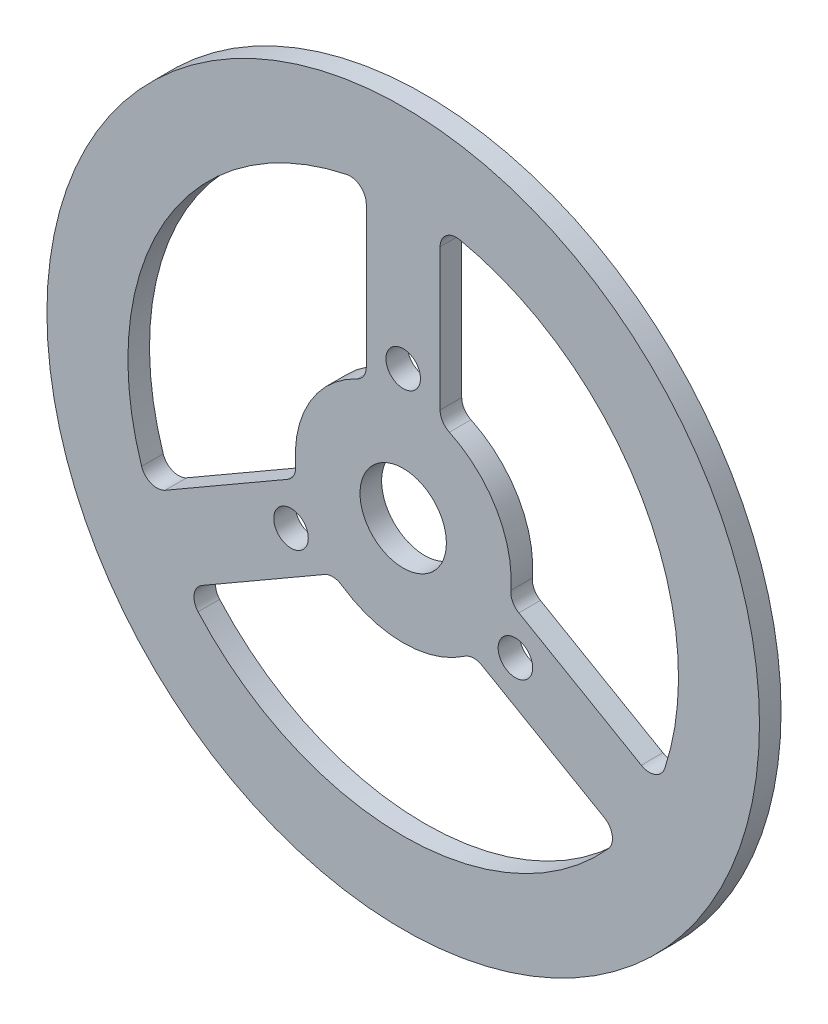
from build123d import *

# Parameters (mm, degrees)
SKETCH1_R                = 33
SKETCH1_R_2              = 4
BOSS_EXTRUDE1_DEPTH      = 2
SKETCH3_R                = 1.6
CUT_EXTRUDE1_DEPTH       = 10
CUT_EXTRUDE2_DEPTH       = 10
FILLET1_R                = 1.5
CIRPATTERN1_COUNT        = 3
FILLET1_OF_CIRPATTERN1_R = 1.5


with BuildPart() as part:
    # Sketch1 → Boss-Extrude1 (new body)
    with BuildSketch(Plane.XY):
        Circle(SKETCH1_R)
        Circle(SKETCH1_R_2, mode=Mode.SUBTRACT)
    extrude(amount=BOSS_EXTRUDE1_DEPTH)

    # Sketch3 → Cut-Extrude1 (cut)
    with BuildSketch(Plane.XY.offset(2)):
        with Locations((0, 12)):
            Circle(SKETCH3_R)
        with Locations((-10.392304845, -6)):
            Circle(SKETCH3_R)
        with Locations((10.392304845, -6)):
            Circle(SKETCH3_R)
    extrude(amount=-CUT_EXTRUDE1_DEPTH, mode=Mode.SUBTRACT)

    # Sketch4 → Cut-Extrude2 (cut)
    with BuildSketch(Plane.XY.offset(2)):
        with BuildLine():
            Line((3.420201433, 25.269590858), (3.420201433, 9.396926208))
            ThreePointArc((3.420201433, 9.396926208), (8.191520443, 5.735764363), (10, 0))
            ThreePointArc((10, 0), (9.961946981, -0.871557427), (9.84807753, -1.736481777))
            Line((9.84807753, -1.736481777), (23.594208343, -9.672814102))
            ThreePointArc((23.594208343, -9.672814102), (25.019015895, -4.929385725), (25.5, 0))
            ThreePointArc((25.5, 0), (19.202410481, 16.77848121), (3.420201433, 25.269590858))
        make_face()
    cut_extrude2 = extrude(amount=-CUT_EXTRUDE2_DEPTH, mode=Mode.SUBTRACT)

    # Fillet1
    fillet1_edges = [part.edges().sort_by_distance(p)[0] for p in [
        (23.594208343, -9.672814102, 1),
        (9.84807753, -1.736481777, 1),
        (3.420201433, 9.396926208, 1),
        (3.420201433, 25.269590858, 1),
    ]]
    fillet(fillet1_edges, radius=FILLET1_R)

    # CirPattern1: Cut-Extrude2 ×3 about axis
    cirpattern1_axis = Axis((0, 0, 2), (0, 0, 1))
    for i in range(1, CIRPATTERN1_COUNT):
        add(cut_extrude2.rotate(cirpattern1_axis, i * 360 / CIRPATTERN1_COUNT), mode=Mode.SUBTRACT)

    # Fillet1 of CirPattern1
    fillet1_of_cirpattern1_edges = [part.edges().sort_by_distance(p)[0] for p in [
        (-3.420201433, 25.269590859, 1),
        (-3.420201433, 9.396926208, 1),
        (-9.84807753, -1.736481777, 1),
        (-23.594208343, -9.672814102, 1),
        (-20.17400691, -15.596776756, 1),
        (-6.427876097, -7.660444431, 1),
        (6.427876097, -7.660444431, 1),
        (20.17400691, -15.596776756, 1),
    ]]
    fillet(fillet1_of_cirpattern1_edges, radius=FILLET1_OF_CIRPATTERN1_R)


solid = part.part
